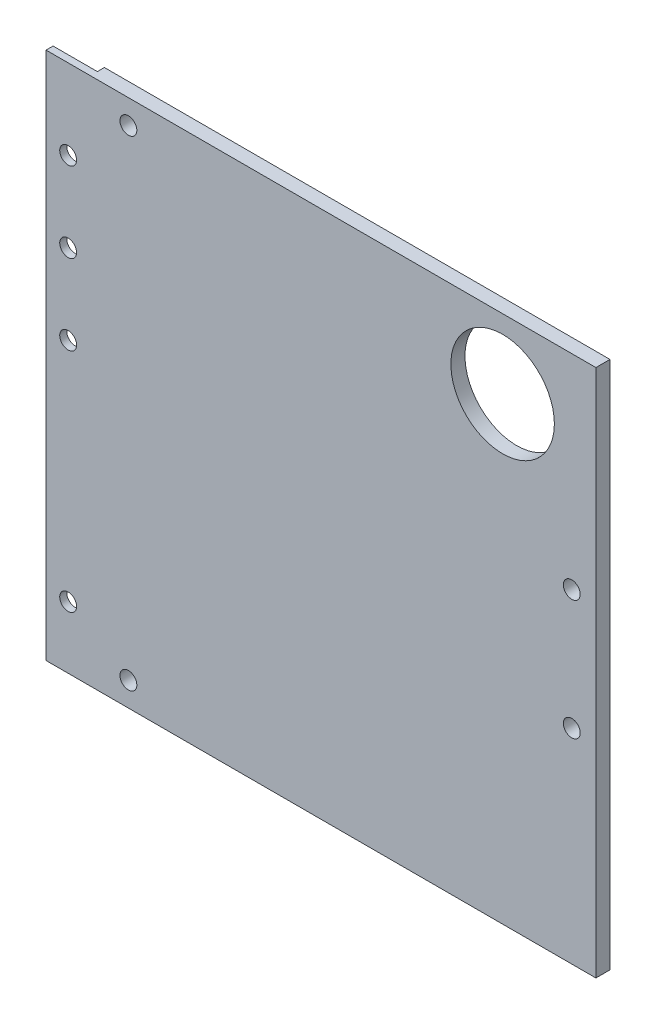
from build123d import *
from OCP.BRepAlgoAPI import BRepAlgoAPI_Cut
from OCP.TopTools import TopTools_ListOfShape

# Parameters (mm, degrees)
SKETCH2_W           = 124.17
SKETCH2_H           = 119.38
BOSS_EXTRUDE1_DEPTH = 3.18
SKETCH3_R           = 1.905
SKETCH3_R_2         = 11.685
CUT_EXTRUDE1_DEPTH  = 23.18
SKETCH5_W           = 1.59
SKETCH5_H           = 120
CUT_EXTRUDE2_DEPTH  = 10
SKETCH6_R           = 1.905
CUT_EXTRUDE3_DEPTH  = 5


with BuildPart() as part:
    # Sketch2 → Boss-Extrude1 (new body)
    with BuildSketch(Plane(origin=(0, -1.061487407, 0), x_dir=(1, 0, 0), z_dir=(0, 0, 1))):
        with Locations((0.708693295, -25.828343308)):
            Rectangle(SKETCH2_W, SKETCH2_H)
    extrude(amount=BOSS_EXTRUDE1_DEPTH)

    # Sketch3 → Cut-Extrude1 (cut)
    with BuildSketch(Plane.XY):
        with Locations((-42.776306705, 27.348169285)):
            Circle(SKETCH3_R)
        with Locations((41.729693295, 17.090169285)):
            Circle(SKETCH3_R_2)
        with Locations((-42.776306705, -81.127830715)):
            Circle(SKETCH3_R)
        with Locations((57.343693295, -13.339830715)):
            Circle(SKETCH3_R)
        with Locations((57.343693295, -40.439830715)):
            Circle(SKETCH3_R)
    extrude(amount=CUT_EXTRUDE1_DEPTH, mode=Mode.SUBTRACT)


with BuildPart() as cut_extrude2_tool:
    # Sketch5 → Cut-Extrude2 (new body)
    with BuildSketch(Plane.ZY.offset(61.376306705)):
        with Locations((0.794999799, -27.199831736)):
            Rectangle(SKETCH5_W, SKETCH5_H)
    extrude(amount=-CUT_EXTRUDE2_DEPTH)


with BuildPart() as part_1:
    add(part.part)

    # Cut-Extrude2: cut by cut_extrude2_tool, with a tolerance
    cut_extrude2_stock = TopTools_ListOfShape()
    cut_extrude2_stock.Append(part_1.part.wrapped)
    cut_extrude2_tools = TopTools_ListOfShape()
    cut_extrude2_tools.Append(cut_extrude2_tool.part.wrapped)
    cut_extrude2_cut = BRepAlgoAPI_Cut()
    cut_extrude2_cut.SetArguments(cut_extrude2_stock)
    cut_extrude2_cut.SetTools(cut_extrude2_tools)
    cut_extrude2_cut.SetFuzzyValue(0.00001)
    cut_extrude2_cut.Build()
    add(Compound.cast(cut_extrude2_cut.Shape()).solids(), mode=Mode.REPLACE)

    # Sketch6 → Cut-Extrude3 (cut)
    with BuildSketch(Plane(origin=(0, 0, 1.589999799), x_dir=(-1, 0, 0), z_dir=(0, 0, -1))):
        with Locations((56.376306705, 14.720168264)):
            Circle(SKETCH6_R)
        with Locations((56.376306705, -21.449831736)):
            Circle(SKETCH6_R)
        with Locations((56.376306705, -72.579830715)):
            Circle(SKETCH6_R)
        with Locations((56.376306705, -3.369831736)):
            Circle(SKETCH6_R)
    extrude(amount=-CUT_EXTRUDE3_DEPTH, mode=Mode.SUBTRACT)


solid = part_1.part
